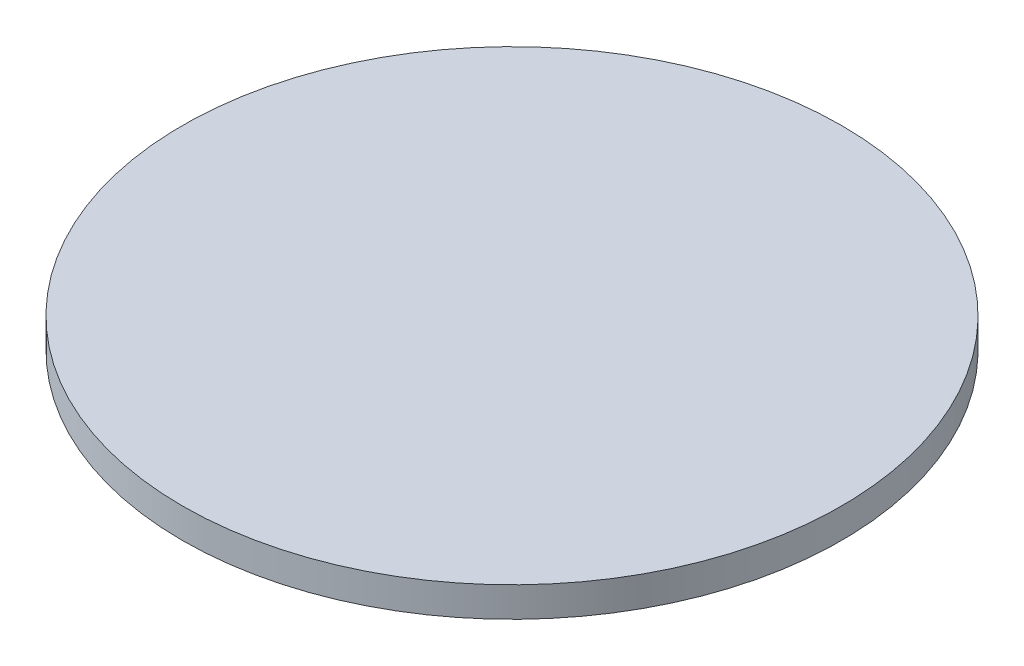
from build123d import *

# Parameters (mm, degrees)
SKETCH1_R = 2.936875
CAP_DEPTH = 0.26662507


with BuildPart() as part:
    # Sketch1 → cap (new body)
    with BuildSketch(Plane(origin=(0, 0, 0), x_dir=(1, 0, 0), z_dir=(0, 1, 0))):
        Circle(SKETCH1_R)
    extrude(amount=CAP_DEPTH)


solid = part.part
